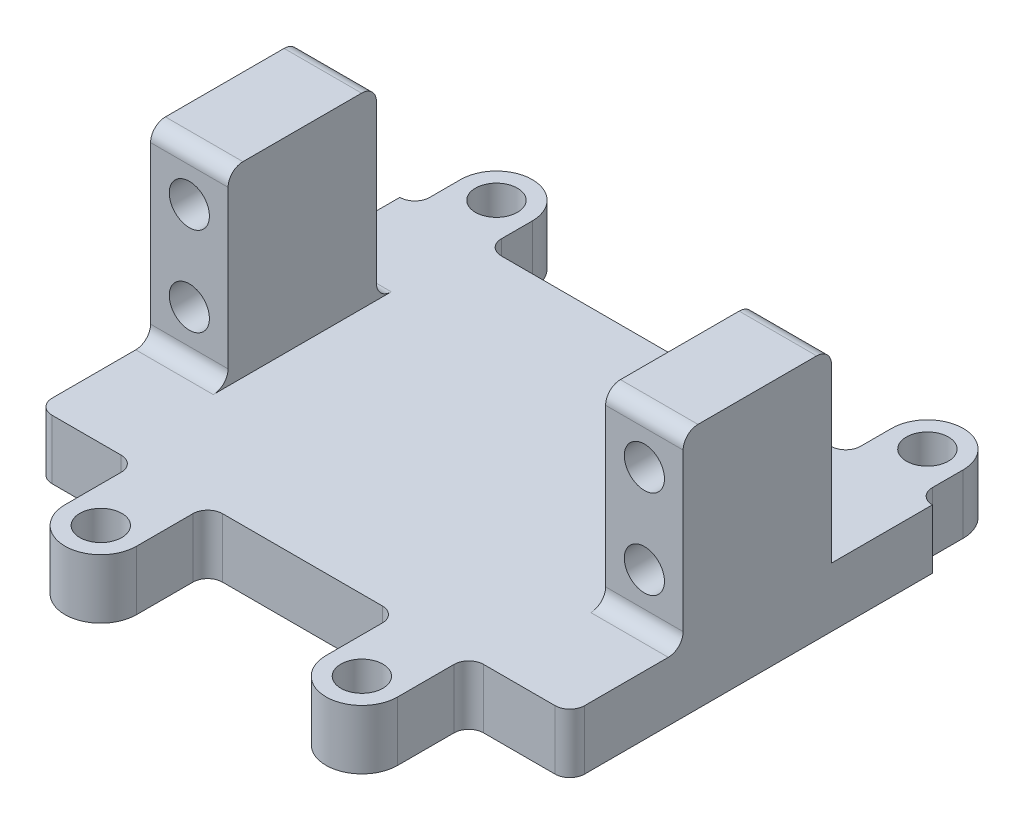
from build123d import *
from build123d.topology import SkipClean

# Parameters (mm, degrees)
SKETCH1_W           = 54.4
SKETCH1_H           = 38.8
BOSS_EXTRUDE1_DEPTH = 3.175
SKETCH2_W           = 7
SKETCH2_H           = 15.875
BOSS_EXTRUDE2_DEPTH = 20
SKETCH3_R           = 3.8354
SKETCH3_R_2         = 2.2479
BOSS_EXTRUDE3_DEPTH = 3.175
LPATTERN1_COUNT     = 2
LPATTERN1_PITCH     = 27.94
SKETCH6_R           = 3.8354
SKETCH6_R_2         = 2.2479
BOSS_EXTRUDE6_DEPTH = 3.175
SKETCH7_R           = 2.150000018
CUT_EXTRUDE1_DEPTH  = 15.875
BOSS_EXTRUDE7_DEPTH = 1.2948
SKETCH11_R          = 2.2479
BOSS_EXTRUDE8_DEPTH = 3.175
FILLET1_R           = 1.5875


with BuildPart() as part:
    # Sketch1 → Boss-Extrude1 (new body)
    with BuildSketch(Plane(origin=(0, 0, 0), x_dir=(1, 0, 0), z_dir=(0, 1, 0))):
        with Locations((27.2, 19.4)):
            Rectangle(SKETCH1_W, SKETCH1_H)
    extrude(amount=BOSS_EXTRUDE1_DEPTH)

    # Sketch2 → Boss-Extrude2 (add)
    with BuildSketch(Plane(origin=(0, 3.175, 0), x_dir=(1, 0, 0), z_dir=(0, 1, 0))):
        with Locations((3.5, 20.0625)):
            Rectangle(SKETCH2_W, SKETCH2_H)
    boss_extrude2 = extrude(amount=BOSS_EXTRUDE2_DEPTH)

    # Mirror1: Boss-Extrude2 across plane
    add(boss_extrude2.mirror(Plane.ZY.offset(-27.2)))

    # Sketch3 → Boss-Extrude3 (add)
    # profile 1 of 2: a face of its own
    with BuildSketch(Plane(origin=(0, 3.175, 0), x_dir=(1, 0, 0), z_dir=(0, 1, 0))):
        with Locations((13.109999942, -7.608)):
            Circle(SKETCH3_R)
        with Locations(Location((13.109999942, -7.608, 0), (0, 0, 270))):
            Circle(SKETCH3_R_2, mode=Mode.SUBTRACT)
    # profile 2 of 2: a face of its own
    with BuildSketch(Plane(origin=(0, 3.175, 0), x_dir=(1, 0, 0), z_dir=(0, 1, 0))):
        with BuildLine():
            Line((9.274599942, 0), (9.274599942, -7.608))
            ThreePointArc((9.274599942, -7.608), (13.109999942, -3.7726), (16.945399942, -7.608))
            Line((16.945399942, -7.608), (16.945399942, 0))
            Line((16.945399942, 0), (9.274599942, 0))
        make_face()
    boss_extrude3 = extrude(amount=-BOSS_EXTRUDE3_DEPTH)

    # LPattern1: Boss-Extrude3 ×2
    with Locations(*[(i * LPATTERN1_PITCH, 0, 0) for i in range(1, LPATTERN1_COUNT)]):
        add(boss_extrude3)

    # Sketch6 → Boss-Extrude6 (add)
    # profile 1 of 2: a face of its own
    with BuildSketch(Plane(origin=(0, 3.175, 0), x_dir=(1, 0, 0), z_dir=(0, 1, 0))):
        with Locations((4.1402, 43.7)):
            Circle(SKETCH6_R)
        with Locations(Location((4.1402, 43.7, 0), (0, 0, 270))):
            Circle(SKETCH6_R_2, mode=Mode.SUBTRACT)
    # profile 2 of 2: a face of its own
    with BuildSketch(Plane(origin=(0, 3.175, 0), x_dir=(1, 0, 0), z_dir=(0, 1, 0))):
        with BuildLine():
            ThreePointArc((7.9756, 43.7), (4.1402, 39.8646), (0.3048, 43.7))
            Line((0.3048, 43.7), (0.3048, 38.8))
            Line((0.3048, 38.8), (7.9756, 38.8))
            Line((7.9756, 38.8), (7.9756, 43.7))
        make_face()
    boss_extrude6 = extrude(amount=-BOSS_EXTRUDE6_DEPTH)

    # Mirror3: Boss-Extrude6 across plane
    add(boss_extrude6.mirror(Plane.ZY.offset(-27.2)))

    # Sketch7 → Cut-Extrude1 (cut)
    with BuildSketch(Plane(origin=(0, 0, -28), x_dir=(-1, 0, 0), z_dir=(0, 0, -1))):
        with Locations((-2.852600116, 17.925)):
            Circle(SKETCH7_R)
        with Locations((-2.852600116, 8.425)):
            Circle(SKETCH7_R)
    cut_extrude1 = extrude(amount=-CUT_EXTRUDE1_DEPTH, mode=Mode.SUBTRACT)

    # Sketch9 → Boss-Extrude7 (add)
    with BuildSketch(Plane.ZY):
        Polygon((-38.8, 0), (-38.8, 3.175), (-28, 3.175), (-28, 23.175), (-12.125, 23.175), (-12.125, 3.175), (0, 3.175), (0, 0), align=None)
    boss_extrude7 = extrude(amount=BOSS_EXTRUDE7_DEPTH)

    # Mirror4: Boss-Extrude7 across plane
    add(boss_extrude7.mirror(Plane.ZY.offset(-27.2)))

    # Mirror5: Cut-Extrude1 across plane
    add(cut_extrude1.mirror(Plane.ZY.offset(-27.2)), mode=Mode.SUBTRACT)

    # Sketch11 → Boss-Extrude8 (add)
    with SkipClean():  # the faces are left unmerged after this step: merging them gives an invalid solid
        with BuildSketch(Plane.XZ):
            with BuildLine():
                Line((0.3048, -38.8), (0.3048, -43.7))
                ThreePointArc((0.3048, -43.7), (4.1402, -47.5354), (7.9756, -43.7))
                Line((7.9756, -43.7), (7.9756, -38.8))
                Line((7.9756, -38.8), (46.4244, -38.8))
                Line((46.4244, -38.8), (46.4244, -43.7))
                ThreePointArc((46.4244, -43.7), (50.2598, -47.5354), (54.0952, -43.7))
                Line((54.0952, -43.7), (54.0952, -38.8))
                Line((54.0952, -38.8), (55.6948, -38.8))
                Line((55.6948, -38.8), (55.6948, 0))
                Line((55.6948, 0), (44.885399942, 0))
                Line((44.885399942, 0), (44.885399942, 7.608))
                ThreePointArc((44.885399942, 7.608), (41.049999942, 11.4434), (37.214599942, 7.608))
                Line((37.214599942, 7.608), (37.214599942, 0))
                Line((37.214599942, 0), (16.945399942, 0))
                Line((16.945399942, 0), (16.945399942, 7.608))
                ThreePointArc((16.945399942, 7.608), (13.109999942, 11.4434), (9.274599942, 7.608))
                Line((9.274599942, 7.608), (9.274599942, 0))
                Line((9.274599942, 0), (-1.2948, 0))
                Line((-1.2948, 0), (-1.2948, -38.8))
                Line((-1.2948, -38.8), (0.3048, -38.8))
            make_face()
            with Locations(Location((4.1402, -43.7, 0), (0, 0, 90))):
                Circle(SKETCH11_R, mode=Mode.SUBTRACT)
            with Locations(Location((50.2598, -43.7, 0), (0, 0, 90))):
                Circle(SKETCH11_R, mode=Mode.SUBTRACT)
            with Locations(Location((41.049999942, 7.608, 0), (0, 0, 90))):
                Circle(SKETCH11_R, mode=Mode.SUBTRACT)
            with Locations(Location((13.109999942, 7.608, 0), (0, 0, 90))):
                Circle(SKETCH11_R, mode=Mode.SUBTRACT)
        extrude(amount=BOSS_EXTRUDE8_DEPTH)
    add(part.part.scale(1), mode=Mode.REPLACE)  # the faces are merged on a copy

    # Fillet1
    fillet1_edges = [part.edges().sort_by_distance(p)[0] for p in [
        (-1.2948, 0, 0),
        (55.6948, 0, 0),
        (2.8526, 3.175, -12.125),
        (2.8526, 3.175, -28),
        (2.8526, 23.175, -12.125),
        (2.8526, 23.175, -28),
        (51.5474, 23.175, -28),
        (51.5474, 23.175, -12.125),
        (51.5474, 3.175, -12.125),
        (16.945399942, 0, 0),
        (9.274599942, 0, 0),
        (44.885399942, 0, 0),
        (37.214599942, 0, 0),
        (0.3048, 0, -38.8),
        (7.9756, 0, -38.8),
        (46.4244, 0, -38.8),
        (54.0952, 0, -38.8),
    ]]
    fillet(fillet1_edges, radius=FILLET1_R)


solid = part.part
